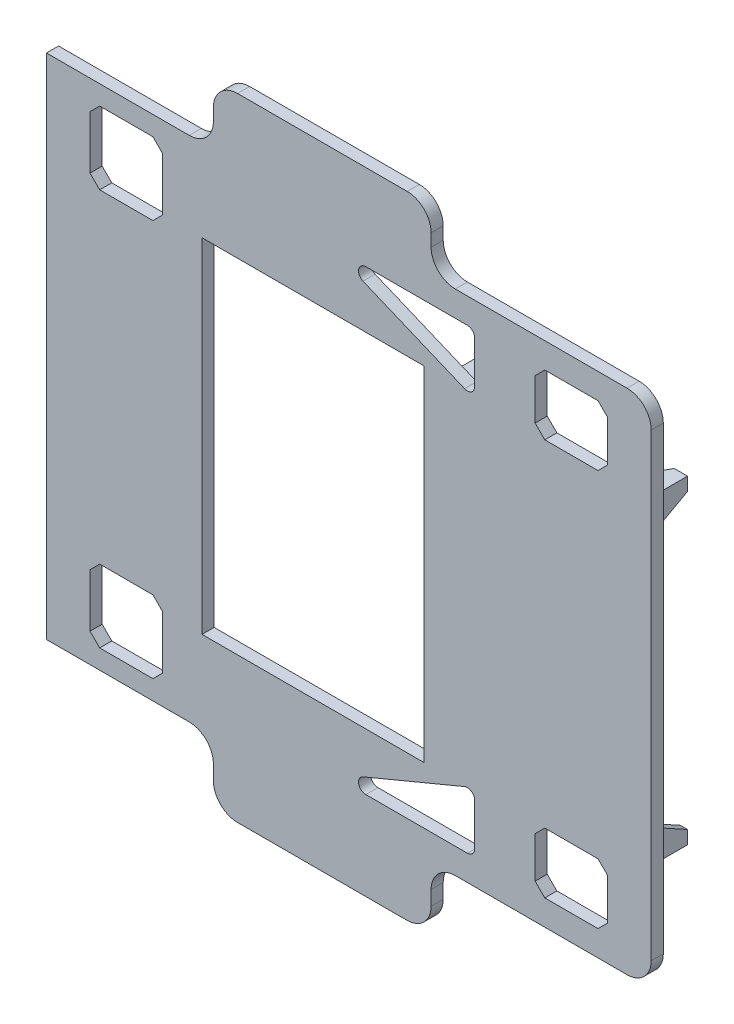
from build123d import *

# Parameters (mm, degrees)
EXTRUDE_1_DEPTH     = 5
SKETCH_2_W          = 30
SKETCH_2_H          = 30
SKETCH_2_H_2        = 25
CUT_EXTRUDE_1_DEPTH = 189.903823128
CHAMFER_1_SIZE      = 4
EXTRUDE_2_DEPTH     = 15
CUT_EXTRUDE_2_DEPTH = 3
CUT_EXTRUDE_3_DEPTH = 3
CUT_EXTRUDE_4_DEPTH = 3
CUT_EXTRUDE_5_DEPTH = 3
FILLET_1_R          = 3
SKETCH_8_W          = 91.7
SKETCH_8_H          = 142
CUT_EXTRUDE_6_DEPTH = 5


with BuildPart() as part:
    # 草图1 → 凸台-拉伸1 (new body)
    with BuildSketch(Plane.XY):
        with BuildLine():
            Line((-45, 115), (-45, 120))
            ThreePointArc((-45, 120), (-42.071067812, 127.071067812), (-35, 130))
            Line((-35, 130), (35.124730195, 130))
            ThreePointArc((35.124730195, 130), (42.10760044, 127.10760044), (45, 120.124730195))
            Line((45, 120.124730195), (45, 115))
            ThreePointArc((45, 115), (47.928932188, 107.928932188), (55, 105))
            Line((55, 105), (126, 105))
            ThreePointArc((126, 105), (133.071067812, 102.071067812), (136, 95))
            Line((136, 95), (136, -95))
            ThreePointArc((136, -95), (133.071067812, -102.071067812), (126, -105))
            Line((126, -105), (115, -105))
            Line((115, -105), (55, -105))
            ThreePointArc((55, -105), (47.928932188, -107.928932188), (45, -115))
            Line((45, -115), (45, -121.010130877))
            ThreePointArc((45, -121.010130877), (42.071067812, -128.081198689), (35, -131.010130877))
            Line((35, -131.010130877), (-35, -131.010130877))
            ThreePointArc((-35, -131.010130877), (-42.071067812, -128.081198689), (-45, -121.010130877))
            Line((-45, -121.010130877), (-45, -115))
            ThreePointArc((-45, -115), (-47.928932188, -107.928932188), (-55, -105))
            Line((-55, -105), (-114, -105))
            Line((-114, -105), (-114, -95))
            Line((-114, -95), (-114, 95))
            Line((-114, 95), (-114, 105))
            Line((-114, 105), (-55, 105))
            ThreePointArc((-55, 105), (-47.928932188, 107.928932188), (-45, 115))
        make_face()
    extrude(amount=EXTRUDE_1_DEPTH)

    # 草图2 → 切除-拉伸1 (cut, through all)
    with BuildSketch(Plane.XY.offset(5)):
        with Locations((-81, 82)):
            Rectangle(SKETCH_2_W, SKETCH_2_H)
        with Locations((-81, -82)):
            Rectangle(SKETCH_2_W, SKETCH_2_H)
        with Locations((103, 82)):
            Rectangle(SKETCH_2_W, SKETCH_2_H_2)
        with Locations((103, -82)):
            Rectangle(SKETCH_2_W, SKETCH_2_H_2)
        Polygon((3, 94.5), (63, 94.5), (63, 69.5), align=None)
        Polygon((3, -94.5), (63, -94.5), (63, -69.5), align=None)
    extrude(amount=-CUT_EXTRUDE_1_DEPTH, mode=Mode.SUBTRACT)

    # 倒角1
    chamfer_1_edges = [part.edges().sort_by_distance(p)[0] for p in [
        (-96, 67, 2.5),
        (-96, -97, 2.5),
        (88, -94.5, 2.5),
        (-96, 97, 2.5),
        (-96, -67, 2.5),
        (88, -69.5, 2.5),
        (-66, -97, 2.5),
        (-66, 67, 2.5),
        (118, -94.5, 2.5),
        (-66, -67, 2.5),
        (118, -69.5, 2.5),
        (-66, 97, 2.5),
        (88, 69.5, 2.5),
        (88, 94.5, 2.5),
        (118, 69.5, 2.5),
        (118, 94.5, 2.5),
    ]]
    chamfer(chamfer_1_edges, length=CHAMFER_1_SIZE)

    # 草图3 → 凸台-拉伸2 (add)
    with BuildSketch(Plane(origin=(0, 0, 0), x_dir=(-1, 0, 0), z_dir=(0, 0, -1))):
        Polygon((-131, 66), (-131, 55), (-128, 55), (-128, 63), (-120, 63), (-120, 66), align=None)
        Polygon((-56, 63), (-56, 66), (-45, 66), (-45, 55), (-48, 55), (-48, 63), align=None)
        Polygon((-48, -63), (-56, -63), (-56, -66), (-45, -66), (-45, -55), (-48, -55), align=None)
        Polygon((-120, -63), (-120, -66), (-131, -66), (-131, -55), (-128, -55), (-128, -63), align=None)
    extrude(amount=EXTRUDE_2_DEPTH)

    # 草图4 → 切除-拉伸2 (cut)
    with BuildSketch(Plane(origin=(131, 0, 0), x_dir=(0, 0, -1), z_dir=(1, 0, 0))):
        Polygon((15, 60.5), (5, 55), (15, 55), align=None)
        Polygon((15, -60.5), (15, -55), (5, -55), align=None)
    extrude(amount=-CUT_EXTRUDE_2_DEPTH, mode=Mode.SUBTRACT)

    # 草图5 → 切除-拉伸3 (cut)
    with BuildSketch(Plane(origin=(0, 66, 0), x_dir=(1, 0, 0), z_dir=(0, 1, 0))):
        Polygon((50.5, 15), (56, 15), (56, 5), align=None)
        Polygon((120, 15), (125.5, 15), (120, 5), align=None)
    extrude(amount=-CUT_EXTRUDE_3_DEPTH, mode=Mode.SUBTRACT)

    # 草图6 → 切除-拉伸4 (cut)
    with BuildSketch(Plane.ZY.offset(-45)):
        Polygon((-15, 60.5), (-5, 55), (-15, 55), align=None)
        Polygon((-15, -60.5), (-15, -55), (-5, -55), align=None)
    extrude(amount=-CUT_EXTRUDE_4_DEPTH, mode=Mode.SUBTRACT)

    # 草图7 → 切除-拉伸5 (cut)
    with BuildSketch(Plane.XZ.offset(66)):
        Polygon((50.5, -15), (56, -15), (56, -5), align=None)
        Polygon((120, -15), (125.5, -15), (120, -5), align=None)
    extrude(amount=-CUT_EXTRUDE_5_DEPTH, mode=Mode.SUBTRACT)

    # 圆角1
    fillet_1_edges = [part.edges().sort_by_distance(p)[0] for p in [
        (63, 69.5, 2.5),
        (3, -94.5, 2.5),
        (3, 94.5, 2.5),
        (63, -94.5, 2.5),
        (63, -69.5, 2.5),
        (63, 94.5, 2.5),
    ]]
    fillet(fillet_1_edges, radius=FILLET_1_R)

    # 草图8 → 切除-拉伸6 (cut)
    with BuildSketch(Plane(origin=(0, 0, 0), x_dir=(-1, 0, 0), z_dir=(0, 0, -1))):
        with Locations((3.85, 0)):
            Rectangle(SKETCH_8_W, SKETCH_8_H)
    extrude(amount=-CUT_EXTRUDE_6_DEPTH, mode=Mode.SUBTRACT)


solid = part.part
